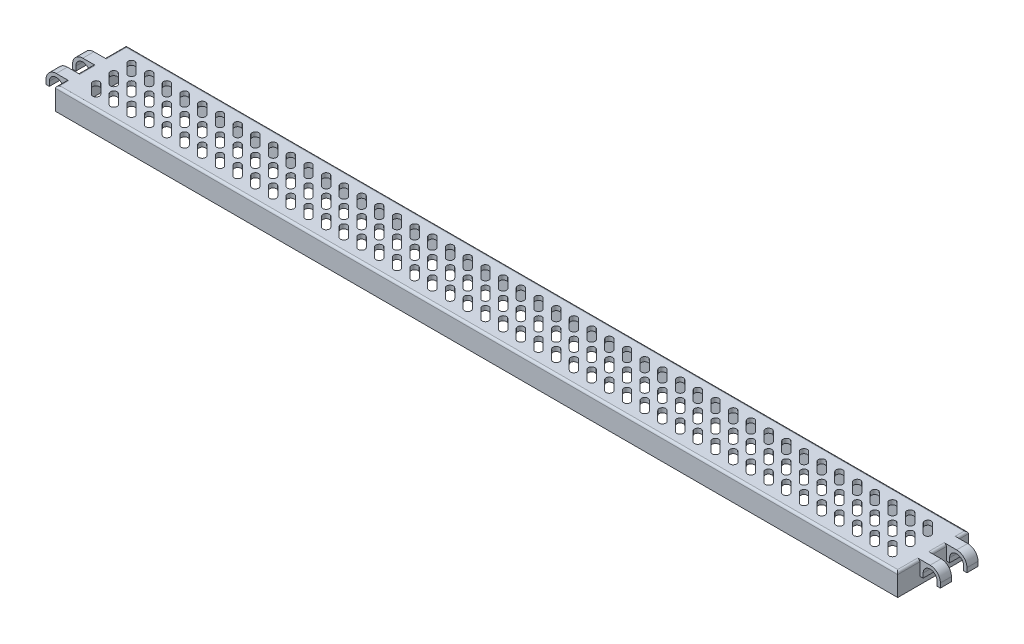
from build123d import *

# Parameters (mm, degrees)
AUFSATZ_LINEAR_AUSTRAGEN2_DEPTH = 16
SKIZZE3_W                       = 9.3
SKIZZE3_H                       = 5
SKIZZE3_H_2                     = 7
SKIZZE3_H_3                     = 10
SCHNITT_LINEAR_AUSTRAGEN1_DEPTH = 201.539578388
SKIZZE4_W                       = 374.7
SKIZZE4_H                       = 26
SCHNITT_LINEAR_AUSTRAGEN2_DEPTH = 8
SCHNITT_LINEAR_AUSTRAGEN3_DEPTH = 201.449800449
LINEARES_MUSTER1_COUNT          = 46
LINEARES_MUSTER1_PITCH          = 8
LINEARES_MUSTER1_COUNT_DIR2     = 3
LINEARES_MUSTER1_PITCH_DIR2     = 8
VERRUNDUNG1_R                   = 1


with BuildPart() as part:
    # Skizze1 → Aufsatz-Linear austragen2 (new, symmetric)
    with BuildSketch(Plane.XY):
        with BuildLine():
            Line((-198.15, 0), (-198.15, -2))
            Line((-198.15, -2), (-199.65, -2))
            Line((-199.65, -2), (-199.65, 0))
            ThreePointArc((-199.65, 0), (-198.288046533, 3.288046533), (-195, 4.65))
            Line((-195, 4.65), (195, 4.65))
            ThreePointArc((195, 4.65), (198.288046533, 3.288046533), (199.65, 0))
            Line((199.65, 0), (199.65, -2))
            Line((199.65, -2), (198.15, -2))
            Line((198.15, -2), (198.15, 0))
            ThreePointArc((198.15, 0), (195, 3.15), (191.85, 0))
            Line((191.85, 0), (191.85, -2))
            Line((191.85, -2), (190.35, -2))
            Line((190.35, -2), (190.35, -5.35))
            Line((190.35, -5.35), (-190.35, -5.35))
            Line((-190.35, -5.35), (-190.35, -2))
            Line((-190.35, -2), (-191.85, -2))
            Line((-191.85, -2), (-191.85, 0))
            ThreePointArc((-191.85, 0), (-195, 3.15), (-198.15, 0))
        make_face()
    extrude(amount=AUFSATZ_LINEAR_AUSTRAGEN2_DEPTH, both=True)

    # Skizze3 → Schnitt-Linear austragen1 (cut, through all)
    with BuildSketch(Plane.XZ.offset(5.35)):
        with Locations((-195, 13.5)):
            Rectangle(SKIZZE3_W, SKIZZE3_H)
        with Locations((-195, 2.5)):
            Rectangle(SKIZZE3_W, SKIZZE3_H_2)
        with Locations((-195, -11)):
            Rectangle(SKIZZE3_W, SKIZZE3_H_3)
        with Locations((195, 11)):
            Rectangle(SKIZZE3_W, SKIZZE3_H_3)
        with Locations((195, -2.5)):
            Rectangle(SKIZZE3_W, SKIZZE3_H_2)
        with Locations((195, -13.5)):
            Rectangle(SKIZZE3_W, SKIZZE3_H)
    extrude(amount=-SCHNITT_LINEAR_AUSTRAGEN1_DEPTH, mode=Mode.SUBTRACT)

    # Skizze4 → Schnitt-Linear austragen2 (cut)
    with BuildSketch(Plane.XZ.offset(5.35)):
        Rectangle(SKIZZE4_W, SKIZZE4_H)
    extrude(amount=-SCHNITT_LINEAR_AUSTRAGEN2_DEPTH, mode=Mode.SUBTRACT)

    # Skizze5 → Schnitt-Linear austragen3 (cut, through all)
    with BuildSketch(Plane.XZ.offset(-2.65)):
        with BuildLine():
            Line((-183.160660172, -9.039339828), (-178.918019485, -4.796699141))
            ThreePointArc((-178.918019485, -4.796699141), (-176.796699141, -4.796699141), (-176.796699141, -6.918019485))
            Line((-176.796699141, -6.918019485), (-181.039339828, -11.160660172))
            ThreePointArc((-181.039339828, -11.160660172), (-183.160660172, -11.160660172), (-183.160660172, -9.039339828))
        make_face()
    schnitt_linear_austragen3 = extrude(amount=-SCHNITT_LINEAR_AUSTRAGEN3_DEPTH, mode=Mode.SUBTRACT)

    # Lineares Muster1: Schnitt-Linear austragen3 46 × 3
    with Locations(*[(i * LINEARES_MUSTER1_PITCH, 0, j * LINEARES_MUSTER1_PITCH_DIR2) for i in range(LINEARES_MUSTER1_COUNT) for j in range(LINEARES_MUSTER1_COUNT_DIR2) if (i, j) != (0, 0)]):
        add(schnitt_linear_austragen3, mode=Mode.SUBTRACT)

    # Verrundung1
    verrundung1_edges = [part.edges().sort_by_distance(p)[0] for p in [
        (-190.35, 4.65, 2.5),
        (-190.35, 4.65, -11),
        (190.35, 4.65, 11),
        (190.35, 4.65, -2.5),
        (190.35, 4.65, -13.5),
        (-190.35, 4.65, 13.5),
        (0, 4.65, -16),
        (0, 4.65, 16),
    ]]
    fillet(verrundung1_edges, radius=VERRUNDUNG1_R)


solid = part.part
